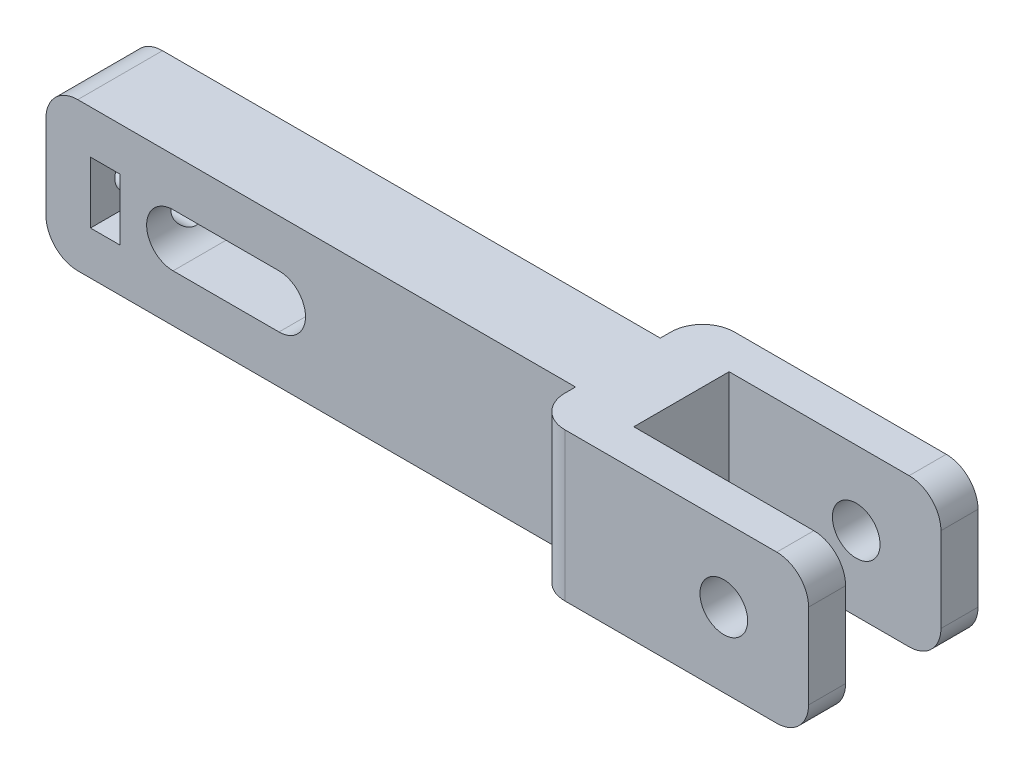
from build123d import *

# Parameters (mm, degrees)
BOSS_EXTRUDE1_DEPTH      = 7
M4_CLEARANCE_HOLE1_D     = 4.5
CUT_EXTRUDE1_DEPTH       = 78.259303647
CUT_EXTRUDE1_DEPTH_BACK  = 78.259303647
CUT_EXTRUDE2_DEPTH       = 2.8
M3_CLEARANCE_HOLE1_D     = 3.4
M3_CLEARANCE_HOLE1_DEPTH = 16
M3_CLEARANCE_HOLE1_TIP   = 1.021463052
FILLET1_R                = 3


with BuildPart() as part:
    # Sketch1 → Boss-Extrude1 (new, symmetric)
    with BuildSketch(Plane(origin=(0, 0, 0), x_dir=(1, 0, 0), z_dir=(0, 1, 0))):
        Polygon((0, -4), (50, -4), (50, -8), (76, -8), (76, -4.5), (56, -4.5), (56, 4.5), (76, 4.5), (76, 8), (50, 8), (50, 4), (0, 4), align=None)
    extrude(amount=BOSS_EXTRUDE1_DEPTH, both=True)

    # M4 Clearance Hole1 (through all)
    with Locations(Plane(origin=(0, 0, -8), x_dir=(-1, 0, 0), z_dir=(0, 0, -1))):
        with Locations((-68, 0)):
            Hole(M4_CLEARANCE_HOLE1_D / 2)

    # Sketch6 → Cut-Extrude1 (cut, two sides: drawn at the far end of the back side and taken through both)
    with BuildSketch(Plane(origin=(0, 0, -4), x_dir=(-1, 0, 0), z_dir=(0, 0, -1)).offset(-CUT_EXTRUDE1_DEPTH_BACK)):
        with BuildLine():
            Line((-12, -2.5), (-22, -2.5))
            ThreePointArc((-22, -2.5), (-24.5, 0), (-22, 2.5))
            Line((-22, 2.5), (-12, 2.5))
            ThreePointArc((-12, 2.5), (-9.5, 0), (-12, -2.5))
        make_face()
    extrude(amount=CUT_EXTRUDE1_DEPTH + CUT_EXTRUDE1_DEPTH_BACK, mode=Mode.SUBTRACT)

    # Sketch7 → Cut-Extrude2 (cut)
    with BuildSketch(Plane.ZY.offset(-7)):
        Polygon((4, -2.9), (4, 2.9), (-1.924315781, 2.9), (-3.598631561, 0), (-1.924315781, -2.9), align=None)
    extrude(amount=CUT_EXTRUDE2_DEPTH, mode=Mode.SUBTRACT)

    # M3 Clearance Hole1
    with Locations(Plane(origin=(0, 0, 0), x_dir=(0, 0, -1), z_dir=(-1, 0, 0))):
        with Locations((0, 0)):
            Hole(M3_CLEARANCE_HOLE1_D / 2, depth=M3_CLEARANCE_HOLE1_DEPTH)
            with Locations((0, 0, -(M3_CLEARANCE_HOLE1_DEPTH + M3_CLEARANCE_HOLE1_TIP / 2))):  # 118° drill point
                Cone(0, M3_CLEARANCE_HOLE1_D / 2, M3_CLEARANCE_HOLE1_TIP, mode=Mode.SUBTRACT)

    # Fillet1
    fillet1_edges = [part.edges().sort_by_distance(p)[0] for p in [
        (50, 0, 8),
        (50, 0, -8),
        (0, -7, 0),
        (0, 7, 0),
        (76, 7, 6.25),
        (76, -7, 6.25),
        (76, -7, -6.25),
        (76, 7, -6.25),
    ]]
    fillet(fillet1_edges, radius=FILLET1_R)


solid = part.part
